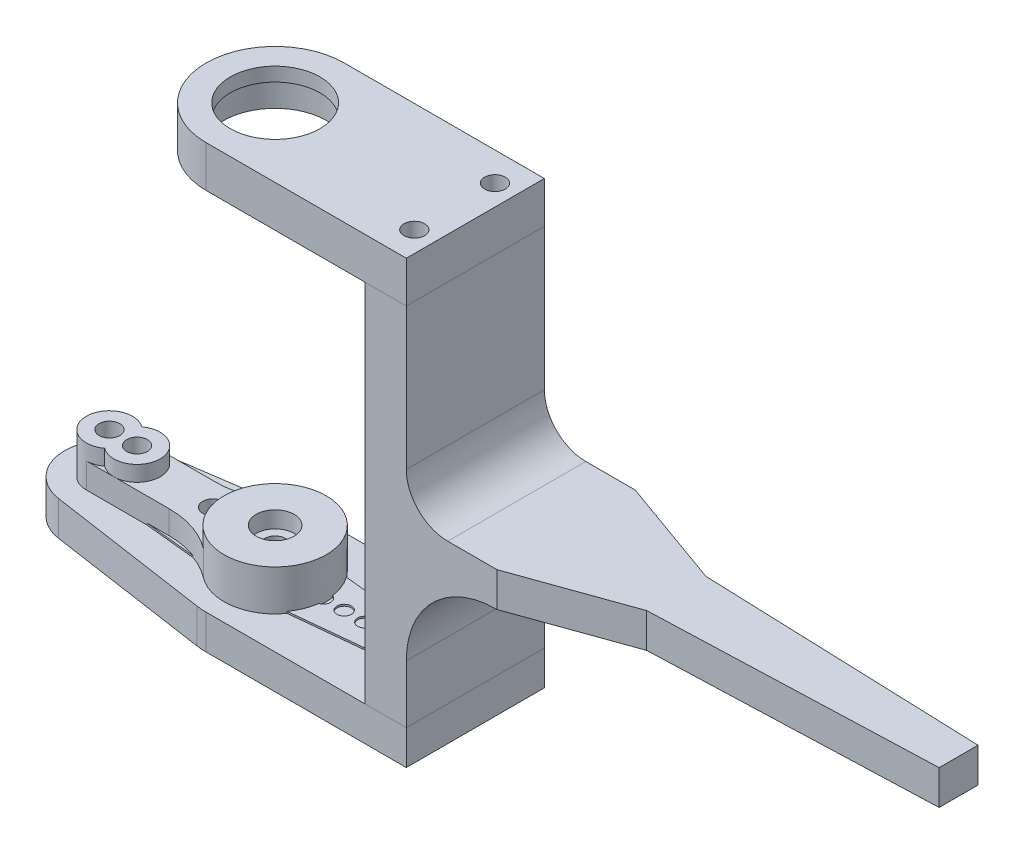
from build123d import *

# Parameters (mm, degrees)
SKETCH2_R                                = 10
BOSS_EXTRUDE1_DEPTH                      = 5
SKETCH3_R                                = 10
BOSS_EXTRUDE2_DEPTH                      = 6
SKETCH4_R                                = 7.5
CUT_EXTRUDE1_DEPTH                       = 4
SKETCH5_R                                = 6.5
CUT_EXTRUDE2_DEPTH                       = 4
MG995_START                              = -0.991050259
MG995_SERVO_HORN_TWO_PRONG_OUTLINE_R     = 1.05
MG995_SERVO_HORN_TWO_PRONG_OUTLINE_R_2   = 3.5
MG995_SERVO_HORN_TWO_PRONG_DEPTH         = 2.25
MG995_START_2                            = -4.191050259
MG995_SERVO_HORN_TWO_PRONG_2_OUTLINE_R   = 4.375
MG995_SERVO_HORN_TWO_PRONG_2_OUTLINE_R_2 = 2.925
MG995_SERVO_HORN_TWO_PRONG_2_DEPTH       = 4.45
MG995_START_3                            = -1.391050259
MG995_SERVO_HORN_TWO_PRONG_3_OUTLINE_R   = 2.925
MG995_SERVO_HORN_TWO_PRONG_3_OUTLINE_R_2 = 1.5
MG995_SERVO_HORN_TWO_PRONG_3_DEPTH       = 1.65
CUT_EXTRUDE3_DEPTH                       = 66.200930898
CUT_EXTRUDE3_DEPTH_BACK                  = 66.200930898
SKETCH6_W                                = 0.691032415
SKETCH6_H                                = 0.410386563
BODY_MOVE_COPY1_ANGLE                    = 180
SKETCH43_W                               = 20
SKETCH43_H                               = 52.9
BOSS_EXTRUDE19_DEPTH                     = 6
BOSS_EXTRUDE20_DEPTH                     = 6
BOSS_EXTRUDE21_START                     = -5
BOSS_EXTRUDE21_DEPTH                     = 5
CUT_EXTRUDE23_DEPTH                      = 71.881661944
CUT_EXTRUDE23_DEPTH_BACK                 = 71.881661944
SKETCH47_R                               = 1.5
SKETCH49_W                               = 70
SKETCH49_H                               = 5
BOSS_EXTRUDE22_DEPTH                     = 20
CUT_EXTRUDE24_DEPTH                      = 105.67688379
CUT_EXTRUDE24_DEPTH_BACK                 = 105.67688379
FILLET1_R                                = 6
FILLET2_R                                = 13
CUT_EXTRUDE28_DEPTH                      = 113.271991164
CUT_EXTRUDE28_DEPTH_BACK                 = 113.271991164
SKETCH54_R                               = 1.5
HORN_START                               = 37.033233578
HORN_25T_METAL_OUTLINE_R                 = 7.4
HORN_25T_METAL_OUTLINE_R_2               = 2.75
HORN_25T_METAL_OUTLINE_R_3               = 1.5
HORN_25T_METAL_DEPTH                     = 5.9
HORN_START_2                             = 39.433233578
HORN_25T_METAL_2_OUTLINE_R               = 1.5
HORN_25T_METAL_2_OUTLINE_R_2             = 2.75
HORN_25T_METAL_2_DEPTH                   = 3.5
HORN_START_3                             = 39.283233578
HORN_25T_METAL_3_OUTLINE_R               = 1.5
HORN_25T_METAL_3_DEPTH                   = 0.15
BODY_MOVE_COPY2_ANGLE                    = 120
BOSS_EXTRUDE23_START                     = -5
BOSS_EXTRUDE23_DEPTH                     = 5
CUT_EXTRUDE29_DEPTH                      = 119.254851909
CUT_EXTRUDE29_DEPTH_BACK                 = 119.254851909
SKETCH57_R                               = 1.5


with BuildPart() as part:
    # Sketch2 → Boss-Extrude1 (new body)
    with BuildSketch(Plane(origin=(0, -6.9, 0), x_dir=(1, 0, 0), z_dir=(0, 1, 0))):
        with Locations(Location((0, 0, 0), (0, 0, 270))):
            Circle(SKETCH2_R)
    extrude(amount=-BOSS_EXTRUDE1_DEPTH)

    # Sketch45 → Boss-Extrude21 (add)
    with BuildSketch(Plane.XZ.offset(11.9).offset(BOSS_EXTRUDE21_START)):
        with BuildLine():
            Line((0, 10), (29, 10))
            Line((29, 10), (29, -10))
            Line((29, -10), (0, -10))
            ThreePointArc((0, -10), (10, 0), (0, 10))
        make_face()
    extrude(amount=BOSS_EXTRUDE21_DEPTH)


with BuildPart() as body_2:
    # Sketch3 → Boss-Extrude2 (new body)
    with BuildSketch(Plane(origin=(0, 46, 0), x_dir=(1, 0, 0), z_dir=(0, 1, 0))):
        with Locations(Location((0, 0, 0), (0, 0, 270))):
            Circle(SKETCH3_R)
    extrude(amount=BOSS_EXTRUDE2_DEPTH)

    # Sketch4 → Cut-Extrude1 (cut)
    with BuildSketch(Plane.XZ.offset(-46)):
        with Locations(Location((0, 0, 0), (0, 0, 270))):
            Circle(SKETCH4_R)
    extrude(amount=-CUT_EXTRUDE1_DEPTH, mode=Mode.SUBTRACT)

    # Sketch5 → Cut-Extrude2 (cut)
    with BuildSketch(Plane.XZ.offset(-50)):
        with Locations(Location((0, 0, 0), (0, 0, 270))):
            Circle(SKETCH5_R)
    extrude(amount=-CUT_EXTRUDE2_DEPTH, mode=Mode.SUBTRACT)

    # Sketch44 → Boss-Extrude20 (add)
    with BuildSketch(Plane(origin=(0, 52, 0), x_dir=(1, 0, 0), z_dir=(0, 1, 0))):
        with BuildLine():
            Line((29, 10), (0, 10))
            ThreePointArc((0, 10), (10, 0), (0, -10))
            Line((0, -10), (29, -10))
            Line((29, -10), (29, 10))
        make_face()
    extrude(amount=-BOSS_EXTRUDE20_DEPTH)


with BuildPart() as body_3:
    # MG995- SERVO HORN TWO PRONG: read off the stored shape, not the designer's step
    # MG995- SERVO HORN TWO PRONG outline → MG995- SERVO HORN TWO PRONG (new body)
    with BuildSketch(Plane(origin=(0, 0, 0), x_dir=(1, 0, 0), z_dir=(0, 1, 0)).offset(MG995_START)):
        with BuildLine():
            ThreePointArc((-5.001086692, 19.366332961), (-5.237928798, 16.375696604), (-5.001086692, 13.385060248))
            Line((-5.001086692, 13.385060248), (9.793444236, 11.875696605))
            ThreePointArc((9.793444236, 11.875696605), (13.762071202, 10.375696605), (17.730698169, 11.875696605))
            Line((17.730698169, 11.875696605), (32.525229097, 13.385060248))
            ThreePointArc((32.525229097, 13.385060248), (32.762071202, 16.375696604), (32.525229097, 19.366332961))
            Line((32.525229097, 19.366332961), (17.730698169, 20.875696605))
            ThreePointArc((17.730698169, 20.875696605), (13.762071202, 22.375696605), (9.793444236, 20.875696605))
            Line((9.793444236, 20.875696605), (-5.001086692, 19.366332961))
        make_face()
        with Locations((-2.237928798, 16.375696605)):
            Circle(MG995_SERVO_HORN_TWO_PRONG_OUTLINE_R, mode=Mode.SUBTRACT)
        with Locations((0.762071202, 16.375696605)):
            Circle(MG995_SERVO_HORN_TWO_PRONG_OUTLINE_R, mode=Mode.SUBTRACT)
        with Locations((3.762071202, 16.375696605)):
            Circle(MG995_SERVO_HORN_TWO_PRONG_OUTLINE_R, mode=Mode.SUBTRACT)
        with Locations((6.762071202, 16.375696605)):
            Circle(MG995_SERVO_HORN_TWO_PRONG_OUTLINE_R, mode=Mode.SUBTRACT)
        with Locations((20.762071202, 16.375696605)):
            Circle(MG995_SERVO_HORN_TWO_PRONG_OUTLINE_R, mode=Mode.SUBTRACT)
        with Locations((23.762071202, 16.375696605)):
            Circle(MG995_SERVO_HORN_TWO_PRONG_OUTLINE_R, mode=Mode.SUBTRACT)
        with Locations((26.762071202, 16.375696605)):
            Circle(MG995_SERVO_HORN_TWO_PRONG_OUTLINE_R, mode=Mode.SUBTRACT)
        with Locations((29.762071202, 16.375696605)):
            Circle(MG995_SERVO_HORN_TWO_PRONG_OUTLINE_R, mode=Mode.SUBTRACT)
        with Locations((13.762071202, 16.375696605)):
            Circle(MG995_SERVO_HORN_TWO_PRONG_OUTLINE_R_2, mode=Mode.SUBTRACT)
    extrude(amount=MG995_SERVO_HORN_TWO_PRONG_DEPTH)

    # MG995- SERVO HORN TWO PRONG 2 outline → MG995- SERVO HORN TWO PRONG 2 (add)
    with BuildSketch(Plane(origin=(0, 0, 0), x_dir=(1, 0, 0), z_dir=(0, 1, 0)).offset(MG995_START_2)):
        with Locations((13.762071202, 16.375696605)):
            Circle(MG995_SERVO_HORN_TWO_PRONG_2_OUTLINE_R)
        with Locations((13.762071202, 16.375696605)):
            Circle(MG995_SERVO_HORN_TWO_PRONG_2_OUTLINE_R_2, mode=Mode.SUBTRACT)
    extrude(amount=MG995_SERVO_HORN_TWO_PRONG_2_DEPTH)

    # MG995- SERVO HORN TWO PRONG 3 outline → MG995- SERVO HORN TWO PRONG 3 (add)
    with BuildSketch(Plane(origin=(0, 0, 0), x_dir=(1, 0, 0), z_dir=(0, 1, 0)).offset(MG995_START_3)):
        with Locations((13.762071202, 16.375696605)):
            Circle(MG995_SERVO_HORN_TWO_PRONG_3_OUTLINE_R)
        with Locations((13.762071202, 16.375696605)):
            Circle(MG995_SERVO_HORN_TWO_PRONG_3_OUTLINE_R_2, mode=Mode.SUBTRACT)
    extrude(amount=MG995_SERVO_HORN_TWO_PRONG_3_DEPTH)

    # Sketch6 → Cut-Extrude3 (cut, two sides: drawn at the far end of the back side and taken through both)
    with BuildSketch(Plane(origin=(0, 0.258949741, 0), x_dir=(1, 0, 0), z_dir=(0, 1, 0)).offset(-CUT_EXTRUDE3_DEPTH_BACK)):
        with Locations((13.762071202, 17.875696604)):
            Rectangle(SKETCH6_W, SKETCH6_H)
    extrude(amount=CUT_EXTRUDE3_DEPTH + CUT_EXTRUDE3_DEPTH_BACK, mode=Mode.SUBTRACT)


with BuildPart() as body_3_1:
    # Body-Move/Copy1: read off the stored shape, not the designer's step
    # Body-Move/Copy1: moved
    add(body_3.part.moved(Location((-13.7620712, 7.6410503, 16.3756966))).rotate(Axis((0, 0, 0), (0, 0, 1)), BODY_MOVE_COPY1_ANGLE))


with BuildPart() as body_4:
    # Sketch43 → Boss-Extrude19 (new body)
    with BuildSketch(Plane(origin=(23, 0, 0), x_dir=(0, 0, -1), z_dir=(1, 0, 0))):
        with Locations((0, 19.55)):
            Rectangle(SKETCH43_W, SKETCH43_H)
    extrude(amount=BOSS_EXTRUDE19_DEPTH)


with BuildPart() as cut_extrude23_tool:
    # Sketch47 → Cut-Extrude23 (new, two sides: drawn at the far end of the back side and taken through both)
    with BuildSketch(Plane(origin=(0, 52, 0), x_dir=(1, 0, 0), z_dir=(0, 1, 0)).offset(-CUT_EXTRUDE23_DEPTH_BACK)):
        with Locations(Location((26, -5.841574982, 0), (0, 0, 270))):
            Circle(SKETCH47_R)
        with Locations(Location((26, 5.841574982, 0), (0, 0, 270))):
            Circle(SKETCH47_R)
    extrude(amount=CUT_EXTRUDE23_DEPTH + CUT_EXTRUDE23_DEPTH_BACK)


with BuildPart() as part_1:
    add(part.part)

    # Cut-Extrude23: cut by cut_extrude23_tool
    add(cut_extrude23_tool.part, mode=Mode.SUBTRACT)

    # Sketch54 → Cut-Extrude28 (cut, two sides: drawn at the far end of the back side and taken through both)
    with BuildSketch(Plane(origin=(0, 0, 0), x_dir=(1, 0, 0), z_dir=(0, 1, 0)).offset(-CUT_EXTRUDE28_DEPTH_BACK)):
        with Locations(Location((0, 0, 0), (0, 0, 270))):
            Circle(SKETCH54_R)
    extrude(amount=CUT_EXTRUDE28_DEPTH + CUT_EXTRUDE28_DEPTH_BACK, mode=Mode.SUBTRACT)

    # Sketch55 → Boss-Extrude23 (add)
    with BuildSketch(Plane.XZ.offset(11.9).offset(BOSS_EXTRUDE23_START)):
        with BuildLine():
            Line((-24.947916667, 6.430509622), (-1.458333333, 9.893091725))
            ThreePointArc((-1.458333333, 9.893091725), (-10, 0), (-1.458333333, -9.893091725))
            Line((-1.458333333, -9.893091725), (-24.947916667, -6.430509622))
            ThreePointArc((-24.947916667, -6.430509622), (-30.5, 0), (-24.947916667, 6.430509622))
        make_face()
    extrude(amount=BOSS_EXTRUDE23_DEPTH)

    # Sketch57 → Cut-Extrude29 (cut, two sides: drawn at the far end of the back side and taken through both)
    with BuildSketch(Plane.XZ.offset(11.9).offset(-CUT_EXTRUDE29_DEPTH_BACK)):
        with Locations(Location((-9, 0, 0), (0, 0, 90))):
            Circle(SKETCH57_R)
        with Locations(Location((-20, 0, 0), (0, 0, 90))):
            Circle(SKETCH57_R)
        with Locations(Location((-24, 0, 0), (0, 0, 90))):
            Circle(SKETCH57_R)
    extrude(amount=CUT_EXTRUDE29_DEPTH + CUT_EXTRUDE29_DEPTH_BACK, mode=Mode.SUBTRACT)


with BuildPart() as body_2_1:
    add(body_2.part)

    # Cut-Extrude23: cut by cut_extrude23_tool
    add(cut_extrude23_tool.part, mode=Mode.SUBTRACT)


with BuildPart() as body_4_1:
    add(body_4.part)

    # Cut-Extrude23: cut by cut_extrude23_tool
    add(cut_extrude23_tool.part, mode=Mode.SUBTRACT)

    # Sketch49 → Boss-Extrude22 (add)
    with BuildSketch(Plane.XY.offset(10)):
        with Locations((64, 17)):
            Rectangle(SKETCH49_W, SKETCH49_H)
    extrude(amount=-BOSS_EXTRUDE22_DEPTH)

    # Sketch50 → Cut-Extrude24 (cut, two sides: drawn at the far end of the back side and taken through both)
    with BuildSketch(Plane(origin=(0, 19.5, 0), x_dir=(1, 0, 0), z_dir=(0, 1, 0)).offset(-CUT_EXTRUDE24_DEPTH_BACK)):
        Polygon((99, 2.813615729), (58.119622414, 4.29172066), (42.142011972, 10), (99, 10), align=None)
        Polygon((99, -10), (99, -2.813615729), (58.119622414, -4.29172066), (42.142011972, -10), align=None)
    extrude(amount=CUT_EXTRUDE24_DEPTH + CUT_EXTRUDE24_DEPTH_BACK, mode=Mode.SUBTRACT)

    # Fillet1
    fillet1_edges = [body_4_1.edges().sort_by_distance(p)[0] for p in [
        (29, 19.5, 0),
    ]]
    fillet(fillet1_edges, radius=FILLET1_R)

    # Fillet2
    fillet2_edges = [body_4_1.edges().sort_by_distance(p)[0] for p in [
        (29, 14.5, 0),
    ]]
    fillet(fillet2_edges, radius=FILLET2_R)


with BuildPart() as body_5:
    # HORN 25T METAL: read off the stored shape, not the designer's step
    # HORN 25T METAL outline → HORN 25T METAL (new body)
    # profile 1 of 2: a face of its own
    with BuildSketch(Plane.XY.offset(HORN_START)):
        with Locations((77.940039679, 42.639661246)):
            Circle(HORN_25T_METAL_OUTLINE_R)
        with Locations((77.940039679, 42.639661246)):
            Circle(HORN_25T_METAL_OUTLINE_R_2, mode=Mode.SUBTRACT)
    # profile 2 of 2: a face of its own
    with BuildSketch(Plane.XY.offset(HORN_START)):
        with BuildLine():
            ThreePointArc((75.252568749, 64.639661246), (77.940039679, 59.289661246), (80.627510609, 64.639661246))
            ThreePointArc((80.627510609, 64.639661246), (77.940039679, 69.989661246), (75.252568749, 64.639661246))
        make_face()
        with Locations((77.940039679, 62.639661246)):
            Circle(HORN_25T_METAL_OUTLINE_R_3, mode=Mode.SUBTRACT)
        with Locations((77.940039679, 66.639661246)):
            Circle(HORN_25T_METAL_OUTLINE_R_3, mode=Mode.SUBTRACT)
    extrude(amount=HORN_25T_METAL_DEPTH)

    # HORN 25T METAL 2 outline → HORN 25T METAL 2 (add)
    # profile 1 of 4: a face of its own
    with BuildSketch(Plane.XY.offset(HORN_START_2)):
        with BuildLine():
            Line((74.590039679, 62.639661246), (74.590039679, 54.639661246))
            ThreePointArc((74.590039679, 54.639661246), (73.938798084, 50.673517785), (72.053463722, 47.123880632))
            ThreePointArc((72.053463722, 47.123880632), (77.940039679, 50.039661246), (83.826615636, 47.123880632))
            ThreePointArc((83.826615636, 47.123880632), (81.941281274, 50.673517785), (81.290039679, 54.639661246))
            Line((81.290039679, 54.639661246), (81.290039679, 62.639661246))
            ThreePointArc((81.290039679, 62.639661246), (77.940039679, 59.289661246), (74.590039679, 62.639661246))
        make_face()
        with Locations((77.940039679, 51.639661246)):
            Circle(HORN_25T_METAL_2_OUTLINE_R, mode=Mode.SUBTRACT)
    # profile 2 of 4: a face of its own
    with BuildSketch(Plane.XY.offset(HORN_START_2)):
        with BuildLine():
            Line((74.590039679, 66.639661246), (74.590039679, 62.639661246))
            ThreePointArc((74.590039679, 62.639661246), (74.759982477, 63.693101416), (75.252568749, 64.639661246))
            ThreePointArc((75.252568749, 64.639661246), (74.759982477, 65.586221076), (74.590039679, 66.639661246))
        make_face()
    # profile 3 of 4: a face of its own
    with BuildSketch(Plane.XY.offset(HORN_START_2)):
        with BuildLine():
            ThreePointArc((80.627510609, 64.639661246), (81.120096881, 63.693101416), (81.290039679, 62.639661246))
            Line((81.290039679, 62.639661246), (81.290039679, 66.639661246))
            ThreePointArc((81.290039679, 66.639661246), (81.120096881, 65.586221076), (80.627510609, 64.639661246))
        make_face()
    # profile 4 of 4: a face of its own
    with BuildSketch(Plane.XY.offset(HORN_START_2)):
        with Locations((77.940039679, 42.639661246)):
            Circle(HORN_25T_METAL_2_OUTLINE_R_2)
        with Locations((77.940039679, 42.639661246)):
            Circle(HORN_25T_METAL_2_OUTLINE_R, mode=Mode.SUBTRACT)
    extrude(amount=HORN_25T_METAL_2_DEPTH)

    # HORN 25T METAL 3 outline → HORN 25T METAL 3 (add)
    # profile 1 of 3: a face of its own
    with BuildSketch(Plane.XY.offset(HORN_START_3)):
        with BuildLine():
            Line((74.590039679, 62.639661246), (74.590039679, 54.639661246))
            ThreePointArc((74.590039679, 54.639661246), (73.938798084, 50.673517785), (72.053463722, 47.123880632))
            ThreePointArc((72.053463722, 47.123880632), (77.940039679, 50.039661246), (83.826615636, 47.123880632))
            ThreePointArc((83.826615636, 47.123880632), (81.941281274, 50.673517785), (81.290039679, 54.639661246))
            Line((81.290039679, 54.639661246), (81.290039679, 62.639661246))
            ThreePointArc((81.290039679, 62.639661246), (77.940039679, 59.289661246), (74.590039679, 62.639661246))
        make_face()
        with Locations((77.940039679, 51.639661246)):
            Circle(HORN_25T_METAL_3_OUTLINE_R, mode=Mode.SUBTRACT)
    # profile 2 of 3: a face of its own
    with BuildSketch(Plane.XY.offset(HORN_START_3)):
        with BuildLine():
            Line((74.590039679, 66.639661246), (74.590039679, 62.639661246))
            ThreePointArc((74.590039679, 62.639661246), (74.759982477, 63.693101416), (75.252568749, 64.639661246))
            ThreePointArc((75.252568749, 64.639661246), (74.759982477, 65.586221076), (74.590039679, 66.639661246))
        make_face()
    # profile 3 of 3: a face of its own
    with BuildSketch(Plane.XY.offset(HORN_START_3)):
        with BuildLine():
            ThreePointArc((80.627510609, 64.639661246), (81.120096881, 63.693101416), (81.290039679, 62.639661246))
            Line((81.290039679, 62.639661246), (81.290039679, 66.639661246))
            ThreePointArc((81.290039679, 66.639661246), (81.120096881, 65.586221076), (80.627510609, 64.639661246))
        make_face()
    extrude(amount=HORN_25T_METAL_3_DEPTH)


with BuildPart() as body_5_1:
    # Body-Move/Copy2: read off the stored shape, not the designer's step
    # Body-Move/Copy2: moved
    add(body_5.part.moved(Location((-77.9400397, -42.6396612, -36.0332336))).rotate(Axis((0, 0, 0), (0.5773502692, -0.5773502692, 0.5773502692)), BODY_MOVE_COPY2_ANGLE))


solid = Compound([body_3_1.part, part_1.part, body_2_1.part, body_4_1.part, body_5_1.part])
